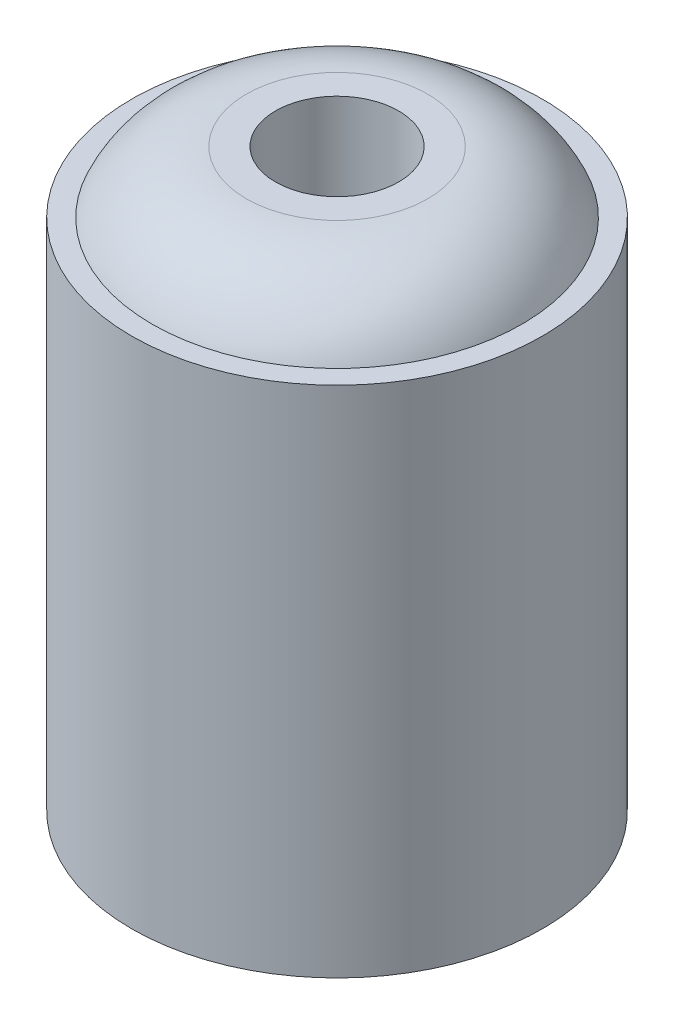
from build123d import *

# Parameters (mm, degrees)
SKETCH1_R           = 10
BOSS_EXTRUDE2_DEPTH = 25
SKETCH2_R           = 9
BOSS_EXTRUDE3_DEPTH = 28
SKETCH3_R           = 3
CUT_EXTRUDE1_DEPTH  = 42
FILLET2_R           = 5


with BuildPart() as part:
    # Sketch1 → Boss-Extrude2 (new body)
    with BuildSketch(Plane(origin=(0, 0, 0), x_dir=(1, 0, 0), z_dir=(0, 1, 0))):
        with Locations(Location((0, 0, 0), (0, 0, 270))):
            Circle(SKETCH1_R)
    extrude(amount=BOSS_EXTRUDE2_DEPTH)

    # Sketch2 → Boss-Extrude3 (add)
    with BuildSketch(Plane(origin=(0, 0, 0), x_dir=(1, 0, 0), z_dir=(0, 1, 0))):
        with Locations(Location((0, 0, 0), (0, 0, 270))):
            Circle(SKETCH2_R)
    extrude(amount=BOSS_EXTRUDE3_DEPTH)

    # Sketch3 → Cut-Extrude1 (cut)
    with BuildSketch(Plane(origin=(0, 0, 0), x_dir=(1, 0, 0), z_dir=(0, 1, 0))):
        with Locations(Location((0, 0, 0), (0, 0, 270))):
            Circle(SKETCH3_R)
    extrude(amount=CUT_EXTRUDE1_DEPTH, mode=Mode.SUBTRACT)

    # Fillet2
    # the kernel refuses this fillet: 5 mm, written as the material it takes off along each edge
    with BuildSketch(Plane(origin=(0, 28, 0), x_dir=(0, 0, 1), z_dir=(-1, 0, 0))) as fillet2_piece_1:
        with BuildLine():
            CenterArc((4.417424305, -5), FILLET2_R, 23.578178478, 66.421821522)
            Line((4.417424305, 0), (4.417424305, 0.1))
            Line((4.417424305, 0.1), (9, 0.1))
            Line((9, 0.1), (9.1, 0))
            ThreePointArc((9.1, 0), (9.1, -1.5), (9.091651514, -2.96))
            Line((9.091651514, -2.96), (9, -3))
        make_face()
    revolve(axis=Axis((0, 28, 0), (0, 1, 0)), mode=Mode.SUBTRACT)


solid = part.part
